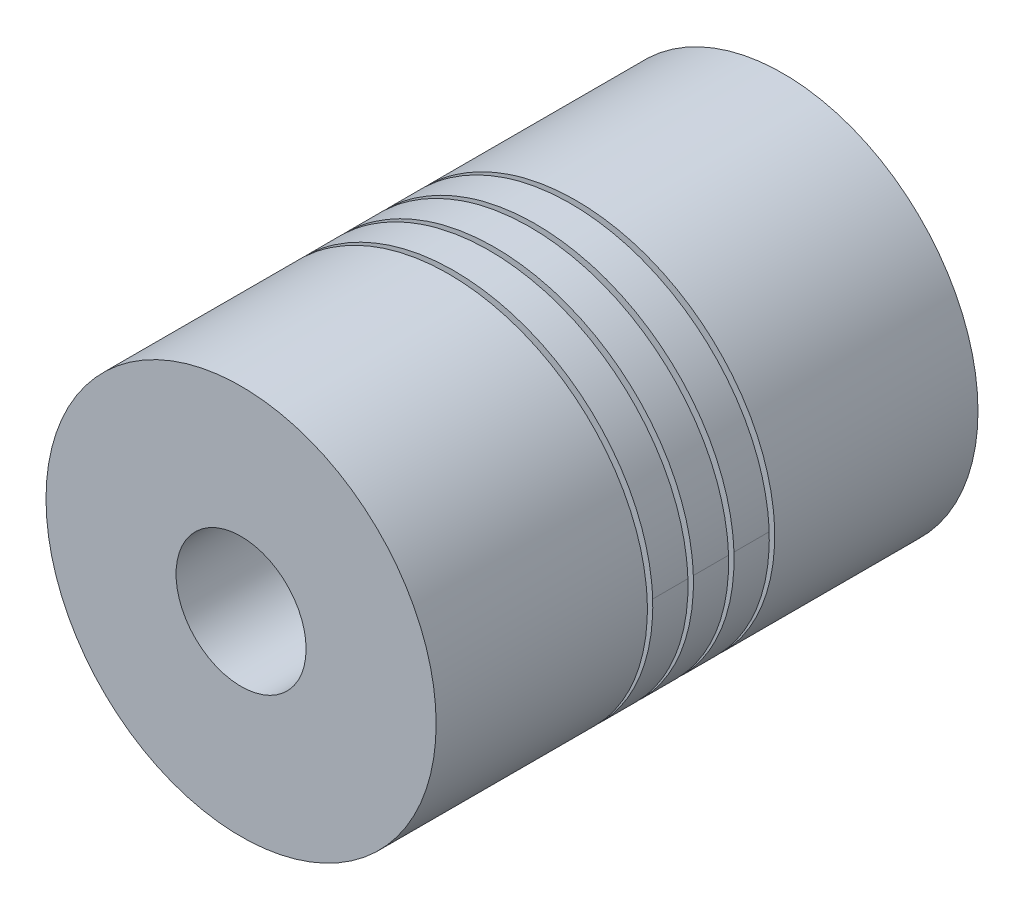
from build123d import *

# Parameters (mm, degrees)
SKETCH1_R           = 9
BOSS_EXTRUDE1_DEPTH = 25
SKETCH2_R           = 3
CUT_EXTRUDE1_DEPTH  = 25
SKETCH3_R           = 4
CUT_EXTRUDE2_DEPTH  = 12.5
CUT_SWEEP1_PITCH    = 1.875


with BuildPart() as part:
    # Sketch1 → Boss-Extrude1 (new body)
    with BuildSketch(Plane.XY):
        Circle(SKETCH1_R)
    extrude(amount=BOSS_EXTRUDE1_DEPTH)

    # Sketch2 → Cut-Extrude1 (cut)
    with BuildSketch(Plane.XY.offset(25)):
        Circle(SKETCH2_R)
    extrude(amount=-CUT_EXTRUDE1_DEPTH, mode=Mode.SUBTRACT)

    # Sketch3 → Cut-Extrude2 (cut)
    with BuildSketch(Plane(origin=(0, 0, 0), x_dir=(-1, 0, 0), z_dir=(0, 0, -1))):
        Circle(SKETCH3_R)
    extrude(amount=-CUT_EXTRUDE2_DEPTH, mode=Mode.SUBTRACT)

    # Cut-Sweep1: the profile of Sketch4 screwed along a right-hand helix of 4 turns, 10 arcs to a turn; built about Z, then put on its axis
    cut_sweep1_z = Axis((0, 0, 0), (0, 0, 1))
    cut_sweep1_corners = [(1.343280354, 0, 0), (1.343280354, 0, 0.25), (9.561008436, 0, 0.25), (9.561008436, 0, 0)]
    with BuildLine(mode=Mode.PRIVATE) as cut_sweep1_profile:
        Line(cut_sweep1_corners[0], cut_sweep1_corners[1])
        Line(cut_sweep1_corners[1], cut_sweep1_corners[2])
        Line(cut_sweep1_corners[2], cut_sweep1_corners[3])
        Line(cut_sweep1_corners[3], cut_sweep1_corners[0])
    cut_sweep1_cap = Face(cut_sweep1_profile.wire())
    cut_sweep1_turn_angles = [0, 18, 36, 54, 72, 90, 108, 126, 144, 162, 180, 198, 216, 234, 252, 270, 288, 306, 324, 342, 360]
    cut_sweep1_turn_weights = [1, 0.9510565162951535, 1, 0.9510565162951535, 1, 0.9510565162951535, 1, 0.9510565162951535, 1, 0.9510565162951535, 1, 0.9510565162951535, 1, 0.9510565162951535, 1, 0.9510565162951535, 1, 0.9510565162951535, 1, 0.9510565162951535, 1]
    cut_sweep1_turn_rails = [Edge.make_bspline([Vector(p[0], p[1], 0).rotate(cut_sweep1_z, cut_sweep1_turn_angles[k]) / cut_sweep1_turn_weights[k] + Vector(0, 0, p[2] + CUT_SWEEP1_PITCH * cut_sweep1_turn_angles[k] / 360) for k in range(21)], [0, 0, 0, 1, 1, 2, 2, 3, 3, 4, 4, 5, 5, 6, 6, 7, 7, 8, 8, 9, 9, 10, 10, 10], 2, cut_sweep1_turn_weights) for p in cut_sweep1_corners]
    cut_sweep1_turn_sides = [Face.make_surface_from_curves(cut_sweep1_turn_rails[p[0]], cut_sweep1_turn_rails[p[1]]) for p in [(0, 1), (1, 2), (2, 3), (3, 0)]]
    cut_sweep1 = Plane(origin=(0, 0, 16.66666667), x_dir=(0, -1, 0), z_dir=(0, 0, -1)) * Solid(Shell([*[p.moved(Location((0, 0, CUT_SWEEP1_PITCH * i))) for i in range(4) for p in cut_sweep1_turn_sides], cut_sweep1_cap, cut_sweep1_cap.rotate(cut_sweep1_z, 1440).moved(Location((0, 0, CUT_SWEEP1_PITCH * 1440 / 360)))]))
    add(cut_sweep1, mode=Mode.SUBTRACT)


solid = part.part
